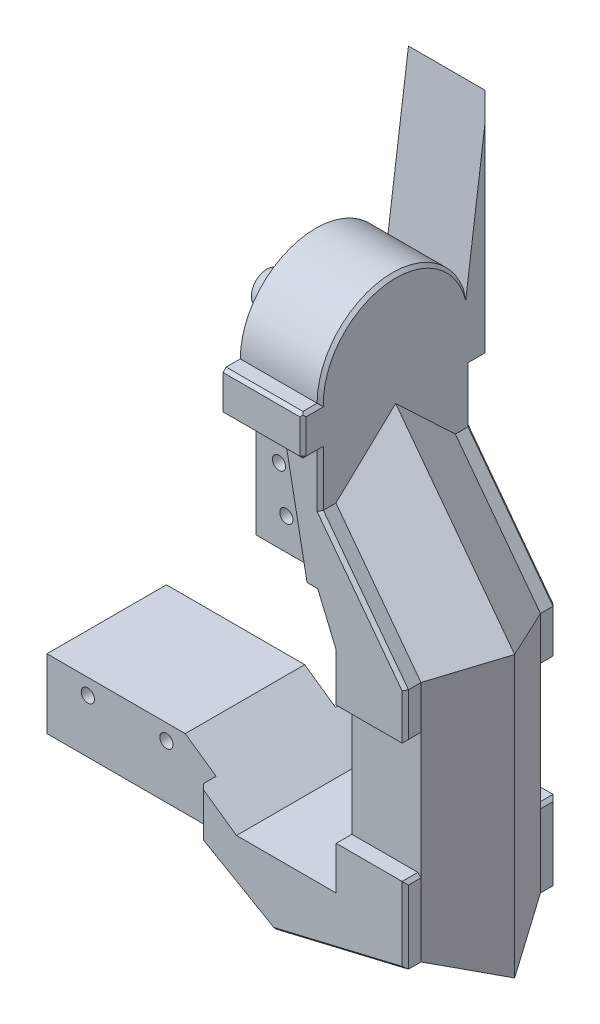
from build123d import *

# Parameters (mm, degrees)
SKETCH_1_R          = 2.1
EXTRUDE_1_DEPTH     = 38
CUT_EXTRUDE_1_DEPTH = 187.709206858
SKETCH_3_R          = 3.15
CUT_EXTRUDE_3_DEPTH = 1
EXTRUDE_2_DEPTH     = 5
EXTRUDE_3_DEPTH     = 5
EXTRUDE_2_2_DEPTH   = 25.432180104
EXTRUDE_7_DEPTH     = 25.432180104
SKETCH_18_W         = 25.432180104
SKETCH_18_H         = 5.5
EXTRUDE_8_DEPTH     = 2.30961622
EXTRUDE_10_DEPTH    = 5.5
SKETCH_21_R         = 5
SKETCH_20_R         = 11.5
SKETCH_23_R         = 3.15
CUT_EXTRUDE_4_DEPTH = 15.5
CHAMFER_1_SIZE      = 1


with BuildPart() as part:
    # 草图1 → 凸台-拉伸1 (new body)
    with BuildSketch(Plane.XY):
        Polygon((0, 0), (53.8, 0), (77, -13.394526245), (119, -3.414420564), (119, 73.585579436), (91.936542927, 109.5), (91.936542927, 158), (66.504362823, 158), (66.504362823, 88), (91.154362823, 88), (97, 74.085579436), (97, 7.085579436), (65.3, 7.085579436), (44, 22), (0, 22), align=None)
        with Locations((73.824362823, 111.53)):
            Circle(SKETCH_1_R, mode=Mode.SUBTRACT)
        with Locations((76.154362823, 98.03)):
            Circle(SKETCH_1_R, mode=Mode.SUBTRACT)
        with Locations((13, 17)):
            Circle(SKETCH_1_R, mode=Mode.SUBTRACT)
        with Locations((38, 17)):
            Circle(SKETCH_1_R, mode=Mode.SUBTRACT)
    extrude(amount=EXTRUDE_1_DEPTH)

    # 草图2 → 切除-拉伸1 (cut, through all)
    with BuildSketch(Plane(origin=(91.936542927, 0, 0), x_dir=(0, 0, -1), z_dir=(1, 0, 0))):
        with BuildLine():
            Line((-38, 158), (-38, 139))
            ThreePointArc((-38, 139), (-32.435028843, 152.435028843), (-19, 158))
            Line((-19, 158), (-38, 158))
        make_face()
        with BuildLine():
            Line((0, 158), (-19, 158))
            ThreePointArc((-19, 158), (-5.564971157, 152.435028843), (0, 139))
            Line((0, 139), (0, 158))
        make_face()
    extrude(amount=-CUT_EXTRUDE_1_DEPTH, mode=Mode.SUBTRACT)

    # 草图3 → 切除-拉伸3 (cut)
    with BuildSketch(Plane.ZY.offset(-66.504362823)):
        with Locations(Location((19, 139, 0), (0, 0, 270))):
            Circle(SKETCH_3_R)
    extrude(amount=-CUT_EXTRUDE_3_DEPTH, mode=Mode.SUBTRACT)

    # 扫描3: sweep along a path in 草图13
    with BuildLine(Plane.XY.offset(19)) as sweep_3_path:
        Line((91.936542927, 127.429097123), (129.79, 77.195862934))
        Line((129.79, 77.195862934), (129.79, -11.941020396))
        Line((129.79, -11.941020396), (77, -24.485062752))
    # 草图4 → 扫描3 (sweep)
    with BuildSketch(Plane.ZY.offset(-77)):
        Polygon((38, -13.394526245), (0, -13.394526245), (19, -24.485062752), align=None)
    sweep(path=sweep_3_path.line, transition=Transition.RIGHT)

    # 草图14 → Extrude 2 (add)
    with BuildSketch(Plane.XY.offset(38)):
        Polygon((66.504362823, 139), (66.504362823, 126.148557267), (80.434084519, 126.148557267), (87.742437222, 88), (91.154362823, 88), (97, 74.085579436), (97, 58.870893274), (118.999906629, 58.870893274), (118.999906629, 73.585548195), (91.936542927, 109.499844851), (91.936542927, 139), align=None)
        Polygon((118.999906629, 20.768869661), (97, 20.768869661), (97, 7.085579436), (65.3, 7.085579436), (53.8, 15.137966126), (53.8, 0), (77, -13.394526245), (118.999906629, -3.414439978), align=None)
    extrude(amount=EXTRUDE_2_DEPTH)

    # 草图15 → 凸台-拉伸3 (add)
    with BuildSketch(Plane(origin=(0, 0, 0), x_dir=(-1, 0, 0), z_dir=(0, 0, -1))):
        Polygon((-118.999906629, 73.585548195), (-118.999906629, 58.870893274), (-97, 58.870893274), (-97, 74.085579436), (-91.154362823, 88), (-87.742437222, 88), (-80.434084519, 126.148557267), (-66.504362823, 126.148557267), (-66.504362823, 139), (-91.936542927, 139), (-91.936542927, 109.499844851), align=None)
        Polygon((-77, -13.394526245), (-53.8, 0), (-53.8, 15.137966126), (-65.3, 7.085579436), (-97, 7.085579436), (-97, 20.768869661), (-118.999906629, 20.768869661), (-118.999906629, -3.414442751), align=None)
    extrude(amount=EXTRUDE_3_DEPTH)

    # 草图16 → Extrude 2 2 (add)
    with BuildSketch(Plane(origin=(91.936542927, 0, 0), x_dir=(0, 0, -1), z_dir=(1, 0, 0))):
        with BuildLine():
            ThreePointArc((-43, 139), (-19, 163), (5, 139))
            Line((5, 139), (-5, 139))
            ThreePointArc((-5, 139), (-19, 153), (-33, 139))
            Line((-33, 139), (-43, 139))
        make_face()
    extrude(amount=-EXTRUDE_2_2_DEPTH)

    # 草图17 → 凸台-拉伸7 (add)
    with BuildSketch(Plane(origin=(91.936542927, 0, 0), x_dir=(0, 0, -1), z_dir=(1, 0, 0))):
        with BuildLine():
            Line((5, 139), (5, 128.458173487))
            Line((5, 128.458173487), (10.5, 128.458173487))
            Line((10.5, 128.458173487), (10.5, 198.458173487))
            Line((10.5, 198.458173487), (3.602302269, 147.070683498))
            ThreePointArc((3.602302269, 147.070683498), (4.647994148, 143.095408742), (5, 139))
        make_face()
    extrude(amount=-EXTRUDE_7_DEPTH)

    # 草图18 → 凸台-拉伸8 (add)
    with BuildSketch(Plane.XZ.offset(-128.458173487)):
        with Locations((79.220452875, -7.75)):
            Rectangle(SKETCH_18_W, SKETCH_18_H)
    extrude(amount=EXTRUDE_8_DEPTH)

    # 草图19 → 凸台-拉伸10 (add)
    with BuildSketch(Plane.XY.offset(43)):
        Polygon((66.504362823, 126.148557267), (80.434084519, 126.148557267), (91.936542927, 126.148557267), (91.936542927, 139), (66.504362823, 139), align=None)
    extrude(amount=EXTRUDE_10_DEPTH)

    # 草图21 → 放样1 section 0
    with BuildSketch(Plane.ZY.offset(-51.004362823)):
        with Locations((19, 139)):
            Circle(SKETCH_21_R)
    # 草图20 → 放样1 section 1
    with BuildSketch(Plane.ZY.offset(-66.504362823)):
        with Locations((19, 139)):
            Circle(SKETCH_20_R)
    loft()

    # 草图23 → 切除-拉伸4 (cut)
    with BuildSketch(Plane.ZY.offset(-51.004362823)):
        with Locations(Location((19, 139, 0), (0, 0, 270))):
            Circle(SKETCH_23_R)
    extrude(amount=-CUT_EXTRUDE_4_DEPTH, mode=Mode.SUBTRACT)

    # 倒角1
    chamfer_1_edges = [part.edges().sort_by_distance(p)[0] for p in [
        (79.220452875, 139, 48.5),
    ]]
    chamfer(chamfer_1_edges, length=CHAMFER_1_SIZE)

    # 倒角3
    # the kernel refuses this chamfer: 1 mm, written as the material it takes off along each edge
    with BuildSketch(Plane(origin=(91.26987626, 126.815223933, 47.833333333), x_dir=(-0.7071067811865475, 0, 0.7071067811865475), z_dir=(0.5773502691896258, -0.5773502691896258, 0.5773502691896258))) as chamfer_3_piece_1:
        Polygon((-0.707106781, -0.40824829), (0.707106781, -0.40824829), (0, 0.816496581), align=None)
    extrude(amount=1.270170592, mode=Mode.SUBTRACT)
    with BuildSketch(Plane(origin=(53.8, 17.709649114, 43), x_dir=(0.9996219169112968, 0, 0.027495876610589005), z_dir=(0, -1, 0)), Plane(origin=(53.8, -2.571682988, -5), x_dir=(0.9996219169112968, 0, -0.027495876610586414), z_dir=(0, 1, 0))) as chamfer_3_piece_2:
        with BuildLine():
            Line((1.028673195, 0), (-0.056547155, -1.027117794))
            Line((-0.056547155, -1.027117794), (-0.076539593, -1.026567876))
            ThreePointArc((-0.076539593, -1.026567876), (-0.034129227, -0.51339783), (-0.019992438, 0.000549918))
            Line((-0.019992438, 0.000549918), (0.000549918, 0.019992438))
            ThreePointArc((0.000549918, 0.019992438), (0.514497665, 0.00585565), (1.029223113, 0.019992438))
            Line((1.029223113, 0.019992438), (1.028673195, 0))
        make_face()
    extrude(amount=20.281332101, mode=Mode.SUBTRACT)
    with BuildSketch(Plane(origin=(118.999906629, 20.768869661, 38), x_dir=(-0.9996219169112968, 0.02749587661058574, 0), z_dir=(0, 0, 1)), Plane(origin=(118.999906629, 58.870893274, 38), x_dir=(0.027495876610582105, 0.999621916911297, 0), z_dir=(0, 0, 1)), Plane(origin=(118.999906629, 58.870893274, 0), x_dir=(-0.9996219169112968, -0.027495876610589196, 0), z_dir=(0, 0, -1))) as chamfer_3_piece_3:
        with BuildLine():
            Line((1.028673195, 0), (-0.056547155, 1.027117794))
            Line((-0.056547155, 1.027117794), (-0.076539593, 1.026567876))
            ThreePointArc((-0.076539593, 1.026567876), (-0.034129227, 0.51339783), (-0.019992438, -0.000549918))
            Line((-0.019992438, -0.000549918), (0.000549918, -0.019992438))
            ThreePointArc((0.000549918, -0.019992438), (0.514497665, -0.00585565), (1.029223113, -0.019992438))
            Line((1.029223113, -0.019992438), (1.028673195, 0))
        make_face()
    extrude(amount=7.571682988, mode=Mode.SUBTRACT)
    with BuildSketch(Plane(origin=(51.572857202, 1.285841494, 43), x_dir=(0.4998109584556499, 0.8656979742248793, 0.027495876610589116), z_dir=(0.8660254037844378, -0.5000000000000017, 0)), Plane(origin=(79.227142798, -14.680367739, -5), x_dir=(0.49981095845565, 0.8656979742248795, -0.027495876610586535), z_dir=(-0.8660254037844378, 0.5000000000000017, 0))) as chamfer_3_piece_4:
        with BuildLine():
            Line((1.028673195, 0), (-0.056547155, -1.027117794))
            Line((-0.056547155, -1.027117794), (-0.076539593, -1.026567876))
            ThreePointArc((-0.076539593, -1.026567876), (-0.034129227, -0.51339783), (-0.019992438, 0.000549918))
            Line((-0.019992438, 0.000549918), (0.000549918, 0.019992438))
            ThreePointArc((0.000549918, 0.019992438), (0.514497665, 0.00585565), (1.029223113, 0.019992438))
            Line((1.029223113, 0.019992438), (1.028673195, 0))
        make_face()
    extrude(amount=31.932418466, mode=Mode.SUBTRACT)
    with BuildSketch(Plane(origin=(74.497984058, -13.989059351, 43), x_dir=(0.006356618994580412, -0.0267510116732474, -0.9996219169112968), z_dir=(0.9729099403562855, 0.23118444574825722, 0))) as chamfer_3_piece_5:
        with BuildLine():
            Line((1.028673195, 0), (-0.056547155, 1.027117794))
            Line((-0.056547155, 1.027117794), (-0.076539593, 1.026567876))
            ThreePointArc((-0.076539593, 1.026567876), (-0.034129227, 0.51339783), (-0.019992438, -0.000549918))
            Line((-0.019992438, -0.000549918), (0.000549918, -0.019992438))
            ThreePointArc((0.000549918, -0.019992438), (0.514497665, -0.00585565), (1.029223113, -0.019992438))
            Line((1.029223113, -0.019992438), (1.028673195, 0))
        make_face()
    extrude(amount=48.312733341, mode=Mode.SUBTRACT)
    with BuildSketch(Plane(origin=(118.999906629, -5.986122965, 43), x_dir=(0.027495876610582105, 0, -0.999621916911297), z_dir=(0, 1, 0))) as chamfer_3_piece_6:
        with BuildLine():
            Line((1.028673195, 0), (-0.056547155, 1.027117794))
            Line((-0.056547155, 1.027117794), (-0.076539593, 1.026567876))
            ThreePointArc((-0.076539593, 1.026567876), (-0.034129227, 0.51339783), (-0.019992438, -0.000549918))
            Line((-0.019992438, -0.000549918), (0.000549918, -0.019992438))
            ThreePointArc((0.000549918, -0.019992438), (0.514497665, -0.00585565), (1.029223113, -0.019992438))
            Line((1.029223113, -0.019992438), (1.028673195, 0))
        make_face()
    extrude(amount=29.326675615, mode=Mode.SUBTRACT)
    with BuildSketch(Plane(origin=(118.999906629, 56.299210286, 43), x_dir=(-0.9996219169112968, 0, 0.027495876610589196), z_dir=(0, 1, 0)), Plane(origin=(118.999906629, 76.157231183, -5), x_dir=(-0.9996219169112968, 0, -0.027495876610586605), z_dir=(0, -1, 0))) as chamfer_3_piece_7:
        with BuildLine():
            Line((1.028673195, 0), (-0.056547155, -1.027117794))
            Line((-0.056547155, -1.027117794), (-0.076539593, -1.026567876))
            ThreePointArc((-0.076539593, -1.026567876), (-0.034129227, -0.51339783), (-0.019992438, 0.000549918))
            Line((-0.019992438, 0.000549918), (0.000549918, 0.019992438))
            ThreePointArc((0.000549918, 0.019992438), (0.514497665, 0.00585565), (1.029223113, 0.019992438))
            Line((1.029223113, 0.019992438), (1.028673195, 0))
        make_face()
    extrude(amount=19.858020896, mode=Mode.SUBTRACT)
    with BuildSketch(Plane(origin=(120.547584086, 71.53171084, 43), x_dir=(-0.7983335594669047, -0.6015874870692686, 0.027495876610589096), z_dir=(-0.60181502315205, 0.7986355100472916, 0))) as chamfer_3_piece_8_section:
        with BuildLine():
            Line((1.028673195, 0), (-0.056547155, -1.027117794))
            Line((-0.056547155, -1.027117794), (-0.076539593, -1.026567876))
            ThreePointArc((-0.076539593, -1.026567876), (-0.034129227, -0.51339783), (-0.019992438, 0.000549918))
            Line((-0.019992438, 0.000549918), (0.000549918, 0.019992438))
            ThreePointArc((0.000549918, 0.019992438), (0.514497665, 0.00585565), (1.029223113, 0.019992438))
            Line((1.029223113, 0.019992438), (1.028673195, 0))
        make_face()
    chamfer_3_piece_8 = extrude(amount=50.112937457, mode=Mode.PRIVATE)
    chamfer_3_piece_8 = split(chamfer_3_piece_8, bisect_by=Plane(origin=(91.936542927, 90.144566019, 42.669249939), z_dir=(1, 0, 0)), keep=Keep.TOP, mode=Mode.PRIVATE)
    add(chamfer_3_piece_8, mode=Mode.SUBTRACT)
    with BuildSketch(Plane(origin=(91.936542927, 106.928161863, 43), x_dir=(0.027495876610582105, 0, -0.999621916911297), z_dir=(0, 1, 0))) as chamfer_3_piece_9_section:
        with BuildLine():
            Line((1.028673195, 0), (-0.056547155, 1.027117794))
            Line((-0.056547155, 1.027117794), (-0.076539593, 1.026567876))
            ThreePointArc((-0.076539593, 1.026567876), (-0.034129227, 0.51339783), (-0.019992438, -0.000549918))
            Line((-0.019992438, -0.000549918), (0.000549918, -0.019992438))
            ThreePointArc((0.000549918, -0.019992438), (0.514497665, -0.00585565), (1.029223113, -0.019992438))
            Line((1.029223113, -0.019992438), (1.028673195, 0))
        make_face()
    chamfer_3_piece_9 = extrude(amount=19.220395404, mode=Mode.PRIVATE)
    chamfer_3_piece_9 = split(chamfer_3_piece_9, bisect_by=Plane(origin=(87.71452173, 115.102656217, 42.667427315), z_dir=(0.7986355100472916, 0.60181502315205, 0)), keep=Keep.TOP, mode=Mode.PRIVATE)
    add(chamfer_3_piece_9, mode=Mode.SUBTRACT)
    with BuildSketch(Plane(origin=(90.38886547, 111.553682205, -5), x_dir=(-0.7983335594669051, -0.6015874870692681, -0.027495876610586504), z_dir=(0.6018150231520495, -0.7986355100472919, 0))) as chamfer_3_piece_10_section:
        with BuildLine():
            Line((1.028673195, 0), (-0.056547155, -1.027117794))
            Line((-0.056547155, -1.027117794), (-0.076539593, -1.026567876))
            ThreePointArc((-0.076539593, -1.026567876), (-0.034129227, -0.51339783), (-0.019992438, 0.000549918))
            Line((-0.019992438, 0.000549918), (0.000549918, 0.019992438))
            ThreePointArc((0.000549918, 0.019992438), (0.514497665, 0.00585565), (1.029223113, 0.019992438))
            Line((1.029223113, 0.019992438), (1.028673195, 0))
        make_face()
    chamfer_3_piece_10 = extrude(amount=50.112937457, mode=Mode.PRIVATE)
    chamfer_3_piece_10 = split(chamfer_3_piece_10, bisect_by=Plane(origin=(91.936542927, 90.144566019, -4.669249939), z_dir=(1, 0, 0)), keep=Keep.TOP, mode=Mode.PRIVATE)
    add(chamfer_3_piece_10, mode=Mode.SUBTRACT)
    with BuildSketch(Plane(origin=(118.999906629, 20.768869661, 0), x_dir=(-0.9996219169112968, 0.02749587661058574, 0), z_dir=(0, 0, -1))) as chamfer_3_piece_11:
        with BuildLine():
            Line((1.028673195, 0), (-0.056547155, -1.027117794))
            Line((-0.056547155, -1.027117794), (-0.076539593, -1.026567876))
            ThreePointArc((-0.076539593, -1.026567876), (-0.034129227, -0.51339783), (-0.019992438, 0.000549918))
            Line((-0.019992438, 0.000549918), (0.000549918, 0.019992438))
            ThreePointArc((0.000549918, 0.019992438), (0.514497665, 0.00585565), (1.029223113, 0.019992438))
            Line((1.029223113, 0.019992438), (1.028673195, 0))
        make_face()
    extrude(amount=7.571682988, mode=Mode.SUBTRACT)
    with BuildSketch(Plane(origin=(118.999906629, 23.340552649, -5), x_dir=(0.02749587661058217, 0, 0.9996219169112968), z_dir=(0, -1, 0))) as chamfer_3_piece_12:
        with BuildLine():
            Line((1.028673195, 0), (-0.056547155, 1.027117794))
            Line((-0.056547155, 1.027117794), (-0.076539593, 1.026567876))
            ThreePointArc((-0.076539593, 1.026567876), (-0.034129227, 0.51339783), (-0.019992438, -0.000549918))
            Line((-0.019992438, -0.000549918), (0.000549918, -0.019992438))
            ThreePointArc((0.000549918, -0.019992438), (0.514497665, -0.00585565), (1.029223113, -0.019992438))
            Line((1.029223113, -0.019992438), (1.028673195, 0))
        make_face()
    extrude(amount=29.326678388, mode=Mode.SUBTRACT)
    with BuildSketch(Plane(origin=(121.501922608, -2.819909801, -5), x_dir=(-0.2310969780314448, 0.9725421140054292, -0.027495876610586514), z_dir=(-0.9729099548061726, -0.231184384937762, 0))) as chamfer_3_piece_13:
        with BuildLine():
            Line((1.028673195, 0), (-0.056547155, -1.027117794))
            Line((-0.056547155, -1.027117794), (-0.076539593, -1.026567876))
            ThreePointArc((-0.076539593, -1.026567876), (-0.034129227, -0.51339783), (-0.019992438, 0.000549918))
            Line((-0.019992438, 0.000549918), (0.000549918, 0.019992438))
            ThreePointArc((0.000549918, 0.019992438), (0.514497665, 0.00585565), (1.029223113, 0.019992438))
            Line((1.029223113, 0.019992438), (1.028673195, 0))
        make_face()
    extrude(amount=48.3127327, mode=Mode.SUBTRACT)
    with BuildSketch(Plane(origin=(91.936542927, 139, 19), x_dir=(0, 0, 1), z_dir=(0, -1, 0))) as chamfer_3_piece_14_section:
        with BuildLine():
            Line((22.971715729, -0.028284271), (24.028284271, 1.028284271))
            Line((24.028284271, 1.028284271), (24.048284271, 1.028284271))
            ThreePointArc((24.048284271, 1.028284271), (24.02, 0.514142136), (24.02, 0))
            Line((24.02, 0), (24, -0.02))
            ThreePointArc((24, -0.02), (23.485857864, -0.02), (22.971715729, -0.048284271))
            Line((22.971715729, -0.048284271), (22.971715729, -0.028284271))
        make_face()
    chamfer_3_piece_14 = revolve(axis=Axis((91.936542927, 139, 19), (-1, 0, 0)), revolution_arc=166.496974045, mode=Mode.PRIVATE)
    chamfer_3_piece_14 = split(chamfer_3_piece_14, bisect_by=Plane(origin=(91.460066415, 158.711193826, -5.164797766), z_dir=(0, 0.13303598850024104, 0.9911112075664182)), keep=Keep.TOP, mode=Mode.PRIVATE)
    add(chamfer_3_piece_14, mode=Mode.SUBTRACT)
    with BuildSketch(Plane(origin=(91.936542927, 123.576874279, -10.5), x_dir=(0.0274958766105822, 0, 0.999621916911297), z_dir=(0, 1, 0))) as chamfer_3_piece_15:
        with BuildLine():
            Line((1.028673195, 0), (-0.056547155, -1.027117794))
            Line((-0.056547155, -1.027117794), (-0.076539593, -1.026567876))
            ThreePointArc((-0.076539593, -1.026567876), (-0.034129227, -0.51339783), (-0.019992438, 0.000549918))
            Line((-0.019992438, 0.000549918), (0.000549918, 0.019992438))
            ThreePointArc((0.000549918, 0.019992438), (0.514497665, 0.00585565), (1.029223113, 0.019992438))
            Line((1.029223113, 0.019992438), (1.028673195, 0))
        make_face()
    extrude(amount=77.452982196, mode=Mode.SUBTRACT)
    with BuildSketch(Plane(origin=(91.936542927, 126.148557267, -5), x_dir=(0.02749587661058217, 0, 0.9996219169112968), z_dir=(0, -1, 0))) as chamfer_3_piece_16_section:
        with BuildLine():
            Line((1.028673195, 0), (-0.056547155, 1.027117794))
            Line((-0.056547155, 1.027117794), (-0.076539593, 1.026567876))
            ThreePointArc((-0.076539593, 1.026567876), (-0.034129227, 0.51339783), (-0.019992438, -0.000549918))
            Line((-0.019992438, -0.000549918), (0.000549918, -0.019992438))
            ThreePointArc((0.000549918, -0.019992438), (0.514497665, -0.00585565), (1.029223113, -0.019992438))
            Line((1.029223113, -0.019992438), (1.028673195, 0))
        make_face()
    chamfer_3_piece_16 = extrude(amount=19.220395404, mode=Mode.PRIVATE)
    chamfer_3_piece_16 = split(chamfer_3_piece_16, bisect_by=Plane(origin=(87.71452173, 115.102656217, -4.667427315), z_dir=(0.7986355100472919, 0.6018150231520495, 0)), keep=Keep.TOP, mode=Mode.PRIVATE)
    add(chamfer_3_piece_16, mode=Mode.SUBTRACT)
    with BuildSketch(Plane(origin=(91.936542927, 126.148557267, -13.071682988), x_dir=(0.02749587661058229, 0.9996219169112968, 0), z_dir=(0, 0, 1)), Plane(origin=(91.936542927, 126.148557267, 43), x_dir=(0.02749587661058229, 0.9996219169112968, 0), z_dir=(0, 0, 1))) as chamfer_3_piece_17:
        with BuildLine():
            Line((1.028673195, 0), (-0.056547155, 1.027117794))
            Line((-0.056547155, 1.027117794), (-0.076539593, 1.026567876))
            ThreePointArc((-0.076539593, 1.026567876), (-0.034129227, 0.51339783), (-0.019992438, -0.000549918))
            Line((-0.019992438, -0.000549918), (0.000549918, -0.019992438))
            ThreePointArc((0.000549918, -0.019992438), (0.514497665, -0.00585565), (1.029223113, -0.019992438))
            Line((1.029223113, -0.019992438), (1.028673195, 0))
        make_face()
    extrude(amount=8.071682988, mode=Mode.SUBTRACT)
    with BuildSketch(Plane(origin=(94.508225915, 126.148557267, 48.5), x_dir=(0, 0.9996219169112968, 0.027495876610589196), z_dir=(-1, 0, 0))) as chamfer_3_piece_18:
        with BuildLine():
            Line((1.028673195, 0), (-0.056547155, 1.027117794))
            Line((-0.056547155, 1.027117794), (-0.076539593, 1.026567876))
            ThreePointArc((-0.076539593, 1.026567876), (-0.034129227, 0.51339783), (-0.019992438, -0.000549918))
            Line((-0.019992438, -0.000549918), (0.000549918, -0.019992438))
            ThreePointArc((0.000549918, -0.019992438), (0.514497665, -0.00585565), (1.029223113, -0.019992438))
            Line((1.029223113, -0.019992438), (1.028673195, 0))
        make_face()
    extrude(amount=30.575546079, mode=Mode.SUBTRACT)
    with BuildSketch(Plane(origin=(91.936542927, 123.576874279, 48.5), x_dir=(0.027495876610582105, 0, -0.999621916911297), z_dir=(0, 1, 0))) as chamfer_3_piece_19:
        with BuildLine():
            Line((1.028673195, 0), (-0.056547155, 1.027117794))
            Line((-0.056547155, 1.027117794), (-0.076539593, 1.026567876))
            ThreePointArc((-0.076539593, 1.026567876), (-0.034129227, 0.51339783), (-0.019992438, -0.000549918))
            Line((-0.019992438, -0.000549918), (0.000549918, -0.019992438))
            ThreePointArc((0.000549918, -0.019992438), (0.514497665, -0.00585565), (1.029223113, -0.019992438))
            Line((1.029223113, -0.019992438), (1.028673195, 0))
        make_face()
    extrude(amount=16.994808709, mode=Mode.SUBTRACT)
    with BuildSketch(Plane(origin=(91.936542927, 139, 40.428317012), x_dir=(-0.999621916911297, 0.027495876610582292, 0), z_dir=(0, 0, 1))) as chamfer_3_piece_20_section:
        with BuildLine():
            Line((1.028673195, 0), (-0.056547155, 1.027117794))
            Line((-0.056547155, 1.027117794), (-0.076539593, 1.026567876))
            ThreePointArc((-0.076539593, 1.026567876), (-0.034129227, 0.51339783), (-0.019992438, -0.000549918))
            Line((-0.019992438, -0.000549918), (0.000549918, -0.019992438))
            ThreePointArc((0.000549918, -0.019992438), (0.514497665, -0.00585565), (1.029223113, -0.019992438))
            Line((1.029223113, -0.019992438), (1.028673195, 0))
        make_face()
    chamfer_3_piece_20 = extrude(amount=9.643365976, mode=Mode.PRIVATE)
    chamfer_3_piece_20 = chamfer_3_piece_20 - Plane(origin=(91.606828487, 139, 19), x_dir=(0, 0, 1), z_dir=(1, 0, 0)) * Cylinder(24, 24, mode=Mode.PRIVATE)
    add(chamfer_3_piece_20, mode=Mode.SUBTRACT)
    with BuildSketch(Plane(origin=(91.936542927, 106.928161863, 43), x_dir=(0.027495876610582105, 0, -0.999621916911297), z_dir=(0, 1, 0))) as chamfer_3_piece_21a_section:
        with BuildLine():
            Line((1.028673195, 0), (-0.056547155, 1.027117794))
            Line((-0.056547155, 1.027117794), (-0.076539593, 1.026567876))
            ThreePointArc((-0.076539593, 1.026567876), (-0.034129227, 0.51339783), (-0.019992438, -0.000549918))
            Line((-0.019992438, -0.000549918), (0.000549918, -0.019992438))
            ThreePointArc((0.000549918, -0.019992438), (0.514497665, -0.00585565), (1.029223113, -0.019992438))
            Line((1.029223113, -0.019992438), (1.028673195, 0))
        make_face()
    chamfer_3_piece_21a = extrude(amount=19.220395404, mode=Mode.PRIVATE)
    chamfer_3_piece_21a = split(chamfer_3_piece_21a, bisect_by=Plane(origin=(92.310865996, 109.003101361, 42.685176958), z_dir=(-0.7986355100472916, -0.60181502315205, 0)), keep=Keep.TOP, mode=Mode.PRIVATE)
    with BuildSketch(Plane(origin=(120.547584086, 71.53171084, 43), x_dir=(-0.7983335594669047, -0.6015874870692686, 0.027495876610589096), z_dir=(-0.60181502315205, 0.7986355100472916, 0))) as chamfer_3_piece_21b_section:
        with BuildLine():
            Line((1.028673195, 0), (-0.056547155, -1.027117794))
            Line((-0.056547155, -1.027117794), (-0.076539593, -1.026567876))
            ThreePointArc((-0.076539593, -1.026567876), (-0.034129227, -0.51339783), (-0.019992438, 0.000549918))
            Line((-0.019992438, 0.000549918), (0.000549918, 0.019992438))
            ThreePointArc((0.000549918, 0.019992438), (0.514497665, 0.00585565), (1.029223113, 0.019992438))
            Line((1.029223113, 0.019992438), (1.028673195, 0))
        make_face()
    chamfer_3_piece_21b = extrude(amount=50.112937457, mode=Mode.PRIVATE)
    chamfer_3_piece_21b = split(chamfer_3_piece_21b, bisect_by=Plane(origin=(91.936542927, 110.121835087, 42.685176958), z_dir=(-1, 0, 0)), keep=Keep.TOP, mode=Mode.PRIVATE)
    chamfer_3_piece_21 = chamfer_3_piece_21a & chamfer_3_piece_21b
    add(chamfer_3_piece_21, mode=Mode.SUBTRACT)
    with BuildSketch(Plane(origin=(91.936542927, 126.148557267, 40.428317012), x_dir=(0.02749587661058229, 0.9996219169112968, 0), z_dir=(0, 0, 1))) as chamfer_3_piece_22a_section:
        with BuildLine():
            Line((1.028673195, 0), (-0.056547155, 1.027117794))
            Line((-0.056547155, 1.027117794), (-0.076539593, 1.026567876))
            ThreePointArc((-0.076539593, 1.026567876), (-0.034129227, 0.51339783), (-0.019992438, -0.000549918))
            Line((-0.019992438, -0.000549918), (0.000549918, -0.019992438))
            ThreePointArc((0.000549918, -0.019992438), (0.514497665, -0.00585565), (1.029223113, -0.019992438))
            Line((1.029223113, -0.019992438), (1.028673195, 0))
        make_face()
    chamfer_3_piece_22a = extrude(amount=10.643365976, mode=Mode.PRIVATE)
    chamfer_3_piece_22a = split(chamfer_3_piece_22a, bisect_by=Plane(origin=(91.6067493, 126.478350894, 43), z_dir=(0, 0, -1)), keep=Keep.TOP, mode=Mode.PRIVATE)
    with BuildSketch(Plane(origin=(91.936542927, 106.928161863, 43), x_dir=(0.027495876610582105, 0, -0.999621916911297), z_dir=(0, 1, 0))) as chamfer_3_piece_22b_section:
        with BuildLine():
            Line((1.028673195, 0), (-0.056547155, 1.027117794))
            Line((-0.056547155, 1.027117794), (-0.076539593, 1.026567876))
            ThreePointArc((-0.076539593, 1.026567876), (-0.034129227, 0.51339783), (-0.019992438, -0.000549918))
            Line((-0.019992438, -0.000549918), (0.000549918, -0.019992438))
            ThreePointArc((0.000549918, -0.019992438), (0.514497665, -0.00585565), (1.029223113, -0.019992438))
            Line((1.029223113, -0.019992438), (1.028673195, 0))
        make_face()
    chamfer_3_piece_22b = extrude(amount=21.792078392, mode=Mode.PRIVATE)
    chamfer_3_piece_22b = split(chamfer_3_piece_22b, bisect_by=Plane(origin=(91.6067493, 126.148557267, 42.670206373), z_dir=(0, 1, 0)), keep=Keep.TOP, mode=Mode.PRIVATE)
    chamfer_3_piece_22 = chamfer_3_piece_22a & chamfer_3_piece_22b
    add(chamfer_3_piece_22, mode=Mode.SUBTRACT)
    with BuildSketch(Plane(origin=(91.936542927, 126.148557267, -5), x_dir=(0.02749587661058217, 0, 0.9996219169112968), z_dir=(0, -1, 0))) as chamfer_3_piece_23a_section:
        with BuildLine():
            Line((1.028673195, 0), (-0.056547155, 1.027117794))
            Line((-0.056547155, 1.027117794), (-0.076539593, 1.026567876))
            ThreePointArc((-0.076539593, 1.026567876), (-0.034129227, 0.51339783), (-0.019992438, -0.000549918))
            Line((-0.019992438, -0.000549918), (0.000549918, -0.019992438))
            ThreePointArc((0.000549918, -0.019992438), (0.514497665, -0.00585565), (1.029223113, -0.019992438))
            Line((1.029223113, -0.019992438), (1.028673195, 0))
        make_face()
    chamfer_3_piece_23a = extrude(amount=19.220395404, mode=Mode.PRIVATE)
    chamfer_3_piece_23a = split(chamfer_3_piece_23a, bisect_by=Plane(origin=(92.310865996, 109.003101361, -4.685176958), z_dir=(-0.7986355100472919, -0.6018150231520495, 0)), keep=Keep.TOP, mode=Mode.PRIVATE)
    with BuildSketch(Plane(origin=(90.38886547, 111.553682205, -5), x_dir=(-0.7983335594669051, -0.6015874870692681, -0.027495876610586504), z_dir=(0.6018150231520495, -0.7986355100472919, 0))) as chamfer_3_piece_23b_section:
        with BuildLine():
            Line((1.028673195, 0), (-0.056547155, -1.027117794))
            Line((-0.056547155, -1.027117794), (-0.076539593, -1.026567876))
            ThreePointArc((-0.076539593, -1.026567876), (-0.034129227, -0.51339783), (-0.019992438, 0.000549918))
            Line((-0.019992438, 0.000549918), (0.000549918, 0.019992438))
            ThreePointArc((0.000549918, 0.019992438), (0.514497665, 0.00585565), (1.029223113, 0.019992438))
            Line((1.029223113, 0.019992438), (1.028673195, 0))
        make_face()
    chamfer_3_piece_23b = extrude(amount=50.112937457, mode=Mode.PRIVATE)
    chamfer_3_piece_23b = split(chamfer_3_piece_23b, bisect_by=Plane(origin=(91.936542927, 110.121835087, -4.685176958), z_dir=(-1, 0, 0)), keep=Keep.TOP, mode=Mode.PRIVATE)
    chamfer_3_piece_23 = chamfer_3_piece_23a & chamfer_3_piece_23b
    add(chamfer_3_piece_23, mode=Mode.SUBTRACT)
    with BuildSketch(Plane(origin=(91.936542927, 139, 40.428317012), x_dir=(-0.999621916911297, 0.027495876610582292, 0), z_dir=(0, 0, 1))) as chamfer_3_piece_24a_section:
        with BuildLine():
            Line((1.028673195, 0), (-0.056547155, 1.027117794))
            Line((-0.056547155, 1.027117794), (-0.076539593, 1.026567876))
            ThreePointArc((-0.076539593, 1.026567876), (-0.034129227, 0.51339783), (-0.019992438, -0.000549918))
            Line((-0.019992438, -0.000549918), (0.000549918, -0.019992438))
            ThreePointArc((0.000549918, -0.019992438), (0.514497665, -0.00585565), (1.029223113, -0.019992438))
            Line((1.029223113, -0.019992438), (1.028673195, 0))
        make_face()
    chamfer_3_piece_24a = extrude(amount=9.643365976, mode=Mode.PRIVATE)
    chamfer_3_piece_24a = chamfer_3_piece_24a & Plane(origin=(91.606531136, 139, 19), x_dir=(0, 0, 1), z_dir=(1, 0, 0)) * Cylinder(24, 24, mode=Mode.PRIVATE)
    with BuildSketch(Plane(origin=(91.936542927, 139, 19), x_dir=(0, -0.10708445732496112, 0.9942499278347565), z_dir=(0, -0.9942499278347565, -0.10708445732496112))) as chamfer_3_piece_24b_section:
        with BuildLine():
            Line((22.971715729, -0.028284271), (24.028284271, 1.028284271))
            Line((24.028284271, 1.028284271), (24.048284271, 1.028284271))
            ThreePointArc((24.048284271, 1.028284271), (24.02, 0.514142136), (24.02, 0))
            Line((24.02, 0), (24, -0.02))
            ThreePointArc((24, -0.02), (23.485857864, -0.02), (22.971715729, -0.048284271))
            Line((22.971715729, -0.048284271), (22.971715729, -0.028284271))
        make_face()
    chamfer_3_piece_24b = revolve(axis=Axis((91.936542927, 139, 19), (-1, 0, 0)), revolution_arc=172.644248448, mode=Mode.PRIVATE)
    chamfer_3_piece_24b = split(chamfer_3_piece_24b, bisect_by=Plane(origin=(91.605315127, 139, 42.627498031), z_dir=(0, -1, 0)), keep=Keep.TOP, mode=Mode.PRIVATE)
    chamfer_3_piece_24 = chamfer_3_piece_24a & chamfer_3_piece_24b
    add(chamfer_3_piece_24, mode=Mode.SUBTRACT)
    with BuildSketch(Plane(origin=(91.936542927, 126.148557267, -13.071682988), x_dir=(0.02749587661058229, 0.9996219169112968, 0), z_dir=(0, 0, 1))) as chamfer_3_piece_25a_section:
        with BuildLine():
            Line((1.028673195, 0), (-0.056547155, 1.027117794))
            Line((-0.056547155, 1.027117794), (-0.076539593, 1.026567876))
            ThreePointArc((-0.076539593, 1.026567876), (-0.034129227, 0.51339783), (-0.019992438, -0.000549918))
            Line((-0.019992438, -0.000549918), (0.000549918, -0.019992438))
            ThreePointArc((0.000549918, -0.019992438), (0.514497665, -0.00585565), (1.029223113, -0.019992438))
            Line((1.029223113, -0.019992438), (1.028673195, 0))
        make_face()
    chamfer_3_piece_25a = extrude(amount=10.643365976, mode=Mode.PRIVATE)
    chamfer_3_piece_25a = split(chamfer_3_piece_25a, bisect_by=Plane(origin=(91.6067493, 126.478350893, -5), z_dir=(0, 0, 1)), keep=Keep.TOP, mode=Mode.PRIVATE)
    with BuildSketch(Plane(origin=(91.936542927, 128.720240255, -5), x_dir=(0.02749587661058217, 0, 0.9996219169112968), z_dir=(0, -1, 0))) as chamfer_3_piece_25b_section:
        with BuildLine():
            Line((1.028673195, 0), (-0.056547155, 1.027117794))
            Line((-0.056547155, 1.027117794), (-0.076539593, 1.026567876))
            ThreePointArc((-0.076539593, 1.026567876), (-0.034129227, 0.51339783), (-0.019992438, -0.000549918))
            Line((-0.019992438, -0.000549918), (0.000549918, -0.019992438))
            ThreePointArc((0.000549918, -0.019992438), (0.514497665, -0.00585565), (1.029223113, -0.019992438))
            Line((1.029223113, -0.019992438), (1.028673195, 0))
        make_face()
    chamfer_3_piece_25b = extrude(amount=21.792078392, mode=Mode.PRIVATE)
    chamfer_3_piece_25b = split(chamfer_3_piece_25b, bisect_by=Plane(origin=(91.6067493, 126.148557267, -4.670206373), z_dir=(0, 1, 0)), keep=Keep.TOP, mode=Mode.PRIVATE)
    chamfer_3_piece_25 = chamfer_3_piece_25a & chamfer_3_piece_25b
    add(chamfer_3_piece_25, mode=Mode.SUBTRACT)


solid = part.part
